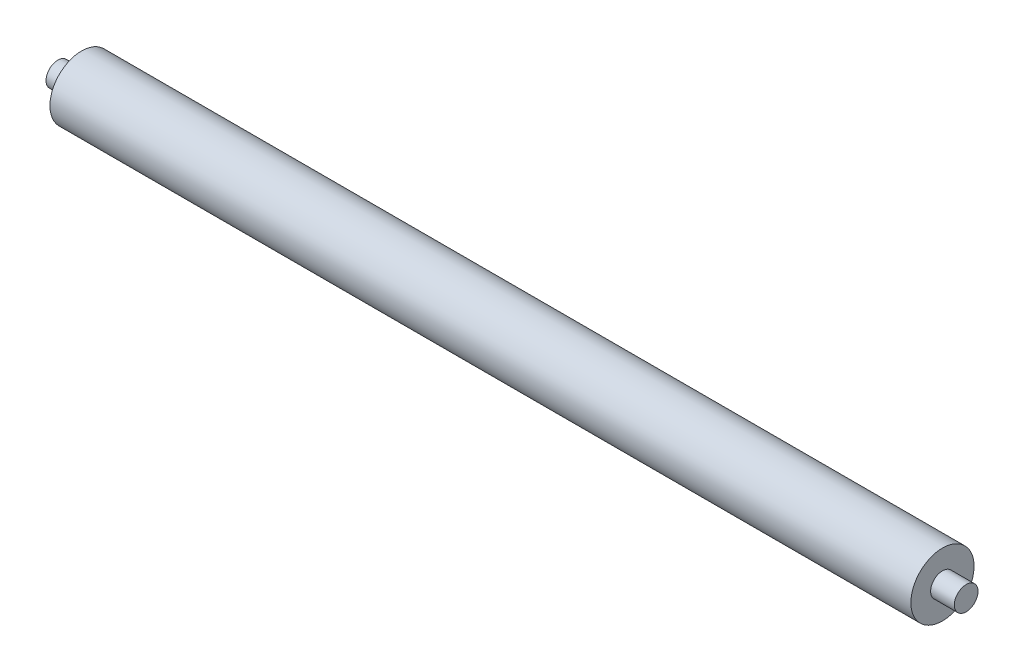
from build123d import *


with BuildPart() as part:
    # Esquisse1 → Révolution1 (revolve)
    with BuildSketch(Plane.XY):
        Polygon((0, 0), (115, 0), (115, 1.5), (112, 1.5), (112, 4), (3, 4), (3, 1.5), (0, 1.5), align=None)
    revolve(axis=Axis((0, 0, 0), (1, 0, 0)))


solid = part.part
